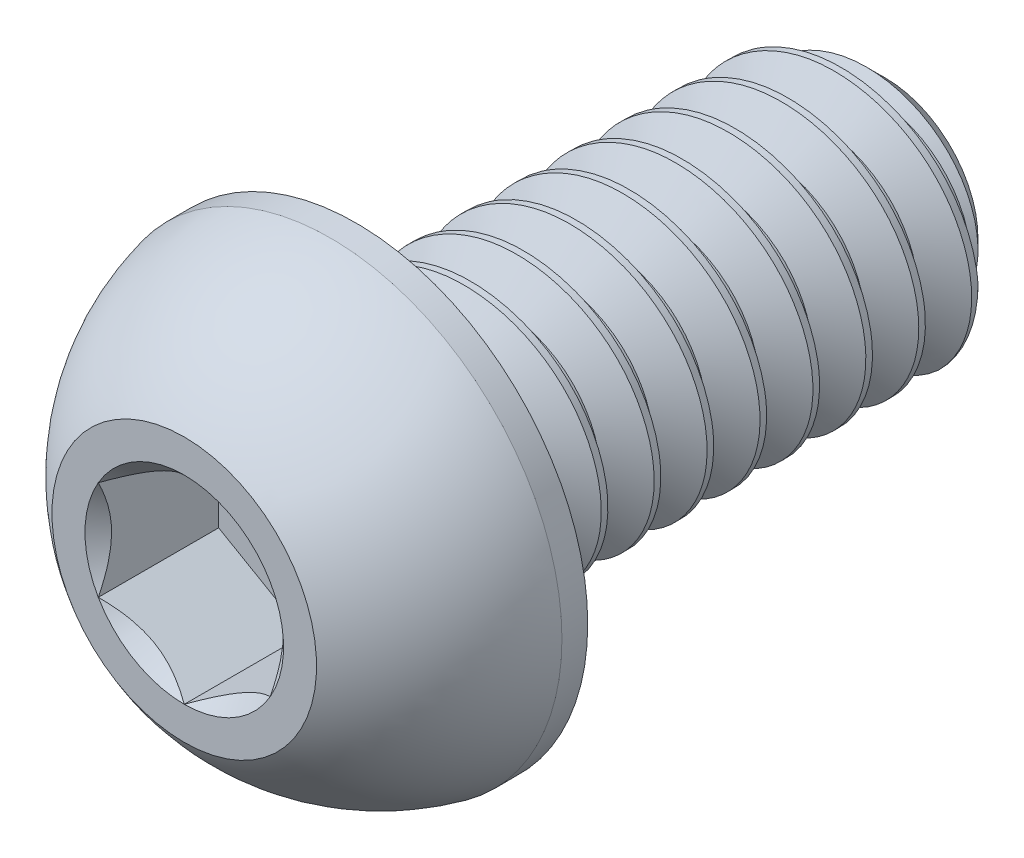
from build123d import *

# Parameters (mm, degrees)
SKETCH1_W          = 4
SKETCH1_H          = 1
CHAMFER1_SIZE      = 0.3
CUT_SWEEP1_PITCH   = 0.4
CUT_EXTRUDE2_DEPTH = 0.91


with BuildPart() as part:
    # Sketch1 → Revolve1 (revolve)
    with BuildSketch(Plane(origin=(0, 0, 0), x_dir=(0, 0, -1), z_dir=(1, 0, 0))):
        with Locations((3.3, 0.5)):
            Rectangle(SKETCH1_W, SKETCH1_H)
    revolve(axis=Axis((0, 0, -5.3), (0, 0, 1)))

    # Chamfer1
    chamfer1_edges = [part.edges().sort_by_distance(p)[0] for p in [
        (0, -1, -5.3),
    ]]
    chamfer(chamfer1_edges, length=CHAMFER1_SIZE)

    # Cut-Sweep1: the profile of Sketch2 profile screwed along a right-hand helix of 11 turns, 6 arcs to a turn; built about Z, then put on its axis
    cut_sweep1_z = Axis((0, 0, 0), (0, 0, 1))
    cut_sweep1_corners = [(1.0003, 0, 0.000173205), (1.0003, 0, -0.350173205), (0.740192379, 0, -0.2), (0.740192379, 0, -0.15)]
    with BuildLine(mode=Mode.PRIVATE) as cut_sweep1_profile:
        Line(cut_sweep1_corners[0], cut_sweep1_corners[1])
        Line(cut_sweep1_corners[1], cut_sweep1_corners[2])
        Line(cut_sweep1_corners[2], cut_sweep1_corners[3])
        Line(cut_sweep1_corners[3], cut_sweep1_corners[0])
    cut_sweep1_cap = Face(cut_sweep1_profile.wire())
    cut_sweep1_turn_angles = [0, 30, 60, 90, 120, 150, 180, 210, 240, 270, 300, 330, 360]
    cut_sweep1_turn_weights = [1, 0.8660254037844387, 1, 0.8660254037844387, 1, 0.8660254037844387, 1, 0.8660254037844387, 1, 0.8660254037844387, 1, 0.8660254037844387, 1]
    cut_sweep1_turn_rails = [Edge.make_bspline([Vector(p[0], p[1], 0).rotate(cut_sweep1_z, cut_sweep1_turn_angles[k]) / cut_sweep1_turn_weights[k] + Vector(0, 0, p[2] + CUT_SWEEP1_PITCH * cut_sweep1_turn_angles[k] / 360) for k in range(13)], [0, 0, 0, 1, 1, 2, 2, 3, 3, 4, 4, 5, 5, 6, 6, 6], 2, cut_sweep1_turn_weights) for p in cut_sweep1_corners]
    cut_sweep1_turn_sides = [Face.make_surface_from_curves(cut_sweep1_turn_rails[p[0]], cut_sweep1_turn_rails[p[1]]) for p in [(0, 1), (1, 2), (2, 3), (3, 0)]]
    cut_sweep1 = Plane(origin=(0, 0, -5.3), x_dir=(0, 1, 0), z_dir=(0, 0, 1)) * Solid(Shell([*[p.moved(Location((0, 0, CUT_SWEEP1_PITCH * i))) for i in range(11) for p in cut_sweep1_turn_sides], cut_sweep1_cap, cut_sweep1_cap.rotate(cut_sweep1_z, 3960).moved(Location((0, 0, CUT_SWEEP1_PITCH * 3960 / 360)))]))
    add(cut_sweep1, mode=Mode.SUBTRACT)

    # Sketch7 → Revolve2 (revolve)
    with BuildSketch(Plane(origin=(0, 0, 0), x_dir=(0, 0, -1), z_dir=(1, 0, 0)), mode=Mode.PRIVATE) as revolve2_sk:
        with BuildLine():
            Line((1.105, 1.75), (1.3, 1.75))
            Line((1.3, 1.75), (1.3, 0))
            Line((1.3, 0), (0, 0))
            Line((0, 0), (0, 1))
            ThreePointArc((0, 1), (0.479976957, 1.481850617), (1.105, 1.75))
        make_face()
    revolve(revolve2_sk.sketch.rotate(Axis((0, 0, 0), (0, 0, -1)), 189.336081704), axis=Axis((0, 0, 0), (0, 0, -1)))

    # Sketch5 → Cut-Extrude2 (cut)
    with BuildSketch(Plane.XY):
        Polygon((0.65, -0.375277675), (0.65, 0.375277675), (0, 0.75055535), (-0.65, 0.375277675), (-0.65, -0.375277675), (0, -0.75055535), align=None)
    extrude(amount=-CUT_EXTRUDE2_DEPTH, mode=Mode.SUBTRACT)

    # Cut-Extrude3 cone 1 section (through the dimple's axis) → Cut-Extrude3 (revolve, cut)
    with BuildSketch(Plane(origin=(0, 0, 0), x_dir=(0, -1, 0), z_dir=(1, 0, 0))):
        Polygon((0, 0), (0.75055535, 0), (0, 0.75055535), align=None)
    revolve(axis=Axis((0, 0, 0), (0, 0, -1)), mode=Mode.SUBTRACT)


solid = part.part
